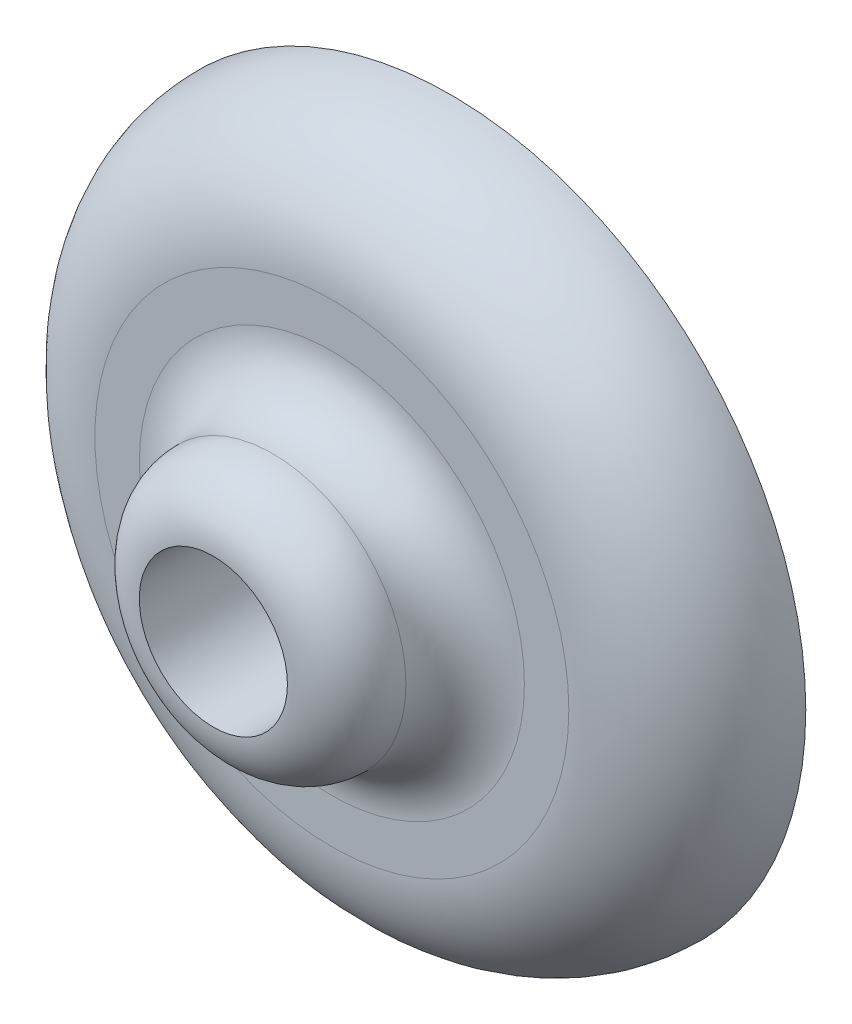
from build123d import *

# Parameters (mm, degrees)
SKETCH1_R           = 6
SKETCH1_R_2         = 1.25
BOSS_EXTRUDE1_DEPTH = 2
SKETCH2_R           = 2.25
SKETCH2_R_2         = 1.25
BOSS_EXTRUDE2_DEPTH = 2
FILLET1_R           = 1
FILLET2_R           = 2


with BuildPart() as part:
    # Sketch1 → Boss-Extrude1 (new body)
    with BuildSketch(Plane.XY):
        Circle(SKETCH1_R)
        Circle(SKETCH1_R_2, mode=Mode.SUBTRACT)
    extrude(amount=BOSS_EXTRUDE1_DEPTH)

    # Sketch2 → Boss-Extrude2 (add)
    with BuildSketch(Plane.XY.offset(2)):
        Circle(SKETCH2_R)
        Circle(SKETCH2_R_2, mode=Mode.SUBTRACT)
    extrude(amount=BOSS_EXTRUDE2_DEPTH)

    # Fillet1
    fillet1_edges = [part.edges().sort_by_distance(p)[0] for p in [
        (-2.25, 0, 4),
        (-2.25, 0, 2),
    ]]
    fillet(fillet1_edges, radius=FILLET1_R - 0.0001)  # a hair under: the kernel refuses the full size

    # Fillet2
    fillet2_edges = [part.edges().sort_by_distance(p)[0] for p in [
        (-6, 0, 2),
    ]]
    fillet(fillet2_edges, radius=FILLET2_R - 0.0001)  # a hair under: the kernel refuses the full size


solid = part.part
